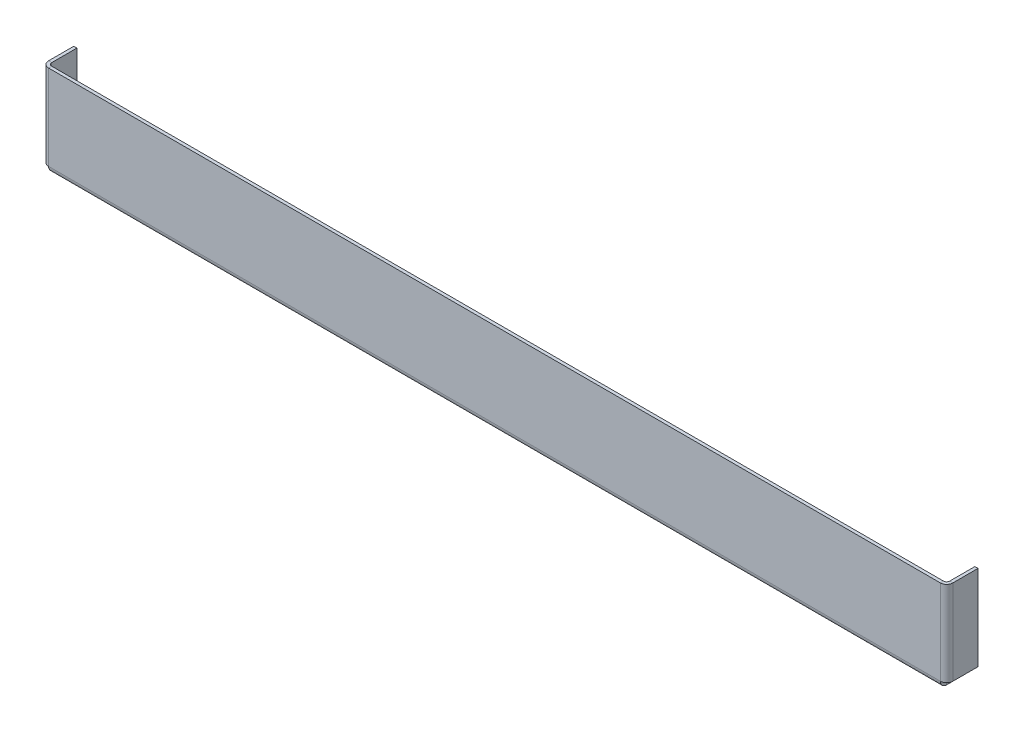
from build123d import *

# Parameters (mm, degrees)
SKETCH_1_W             = 426
SKETCH_1_H             = 40.7
SM_BASE_FLANGE_1_DEPTH = 1.5
SM_EDGE_FLANGE_2_DEPTH = 40.7
SM_EDGE_FLANGE_3_DEPTH = 426
SM_EDGE_FLANGE_4_DEPTH = 40.7


# Sheet-metal steps are written as plain solids
with BuildPart() as part:
    # Sketch 1 → Базовая кромка1 (new body)
    with BuildSketch(Plane.XY):
        with Locations((213, 20.35)):
            Rectangle(SKETCH_1_W, SKETCH_1_H)
    extrude(amount=-SM_BASE_FLANGE_1_DEPTH)

    # Ребро-кромка2 section (across the edge) → Ребро-кромка2 (add)
    with BuildSketch(Plane(origin=(-1.5, 0, -1.5), x_dir=(1, 0, 0), z_dir=(0, 1, 0))):
        with BuildLine():
            Line((-1.5, 1.5), (-1.5, 13.5))
            Line((-1.5, 13.5), (0, 13.5))
            Line((0, 13.5), (0, 1.5))
            ThreePointArc((0, 1.5), (0.439339828, 0.439339828), (1.5, 0))
            Line((1.5, 0), (1.5, -1.5))
            ThreePointArc((1.5, -1.5), (-0.621320344, -0.621320344), (-1.5, 1.5))
        make_face()
    extrude(amount=SM_EDGE_FLANGE_2_DEPTH)

    # Ребро-кромка3 section (across the edge) → Ребро-кромка3 (add)
    with BuildSketch(Plane(origin=(426, -1.5, -1.5), x_dir=(0, 1, 0), z_dir=(-1, 0, 0))):
        with BuildLine():
            Line((-1.5, 1.5), (-1.5, 13.5))
            Line((-1.5, 13.5), (0, 13.5))
            Line((0, 13.5), (0, 1.5))
            ThreePointArc((0, 1.5), (0.439339828, 0.439339828), (1.5, 0))
            Line((1.5, 0), (1.5, -1.5))
            ThreePointArc((1.5, -1.5), (-0.621320344, -0.621320344), (-1.5, 1.5))
        make_face()
    extrude(amount=SM_EDGE_FLANGE_3_DEPTH)

    # Ребро-кромка4 section (across the edge) → Ребро-кромка4 (add)
    with BuildSketch(Plane(origin=(427.5, 40.7, -1.5), x_dir=(-1, 0, 0), z_dir=(0, -1, 0))):
        with BuildLine():
            Line((-1.5, 1.5), (-1.5, 13.5))
            Line((-1.5, 13.5), (0, 13.5))
            Line((0, 13.5), (0, 1.5))
            ThreePointArc((0, 1.5), (0.439339828, 0.439339828), (1.5, 0))
            Line((1.5, 0), (1.5, -1.5))
            ThreePointArc((1.5, -1.5), (-0.621320344, -0.621320344), (-1.5, 1.5))
        make_face()
    extrude(amount=SM_EDGE_FLANGE_4_DEPTH)


solid = part.part
